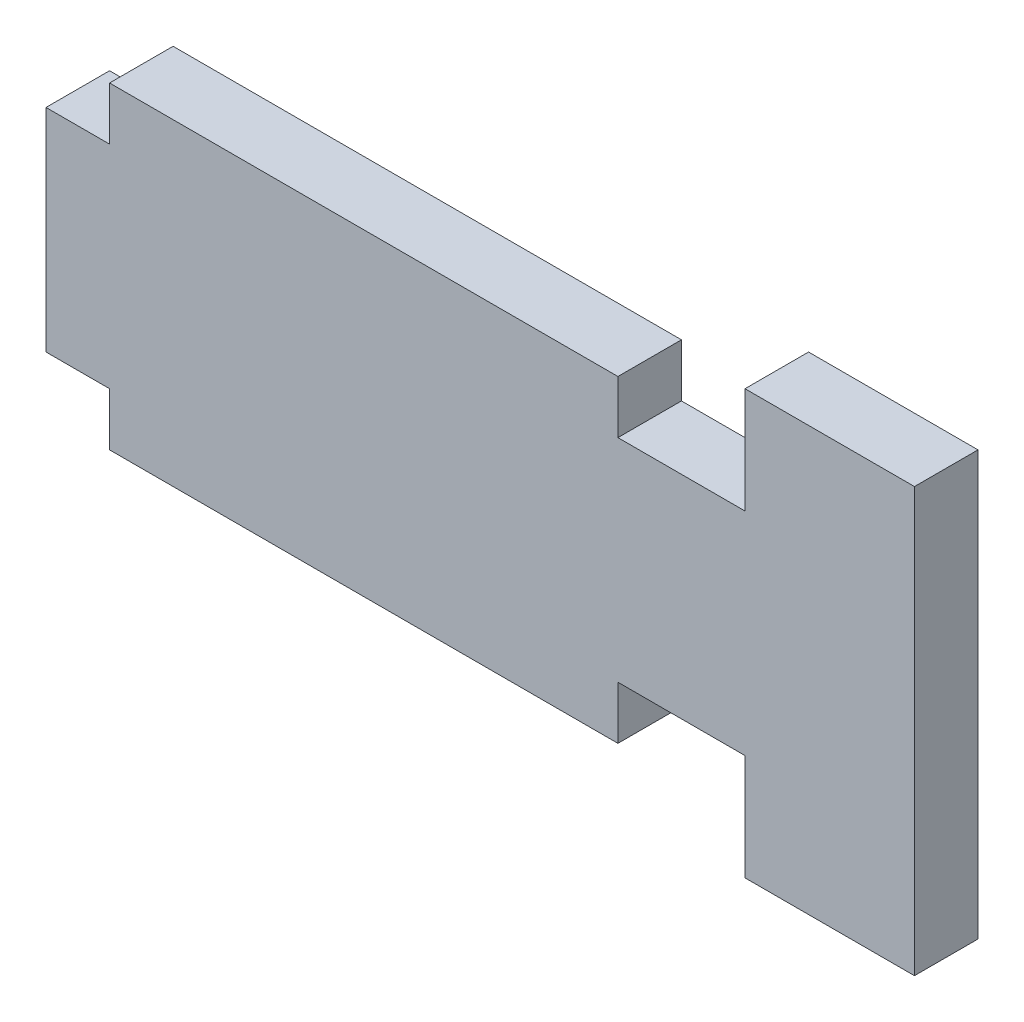
from build123d import *

# Parameters (mm, degrees)
RESSALTO_EXTRUS_O1_DEPTH = 3


with BuildPart() as part:
    # Esboço1 → Ressalto-extrusão1 (new body)
    with BuildSketch(Plane.XY):
        Polygon((-12, -5), (-12, -7.5), (12, -7.5), (12, -5), (18, -5), (18, -10), (26, -10), (26, 10), (18, 10), (18, 5), (12, 5), (12, 7.5), (-12, 7.5), (-12, 5), (-15, 5), (-15, -5), align=None)
    extrude(amount=RESSALTO_EXTRUS_O1_DEPTH)


solid = part.part
